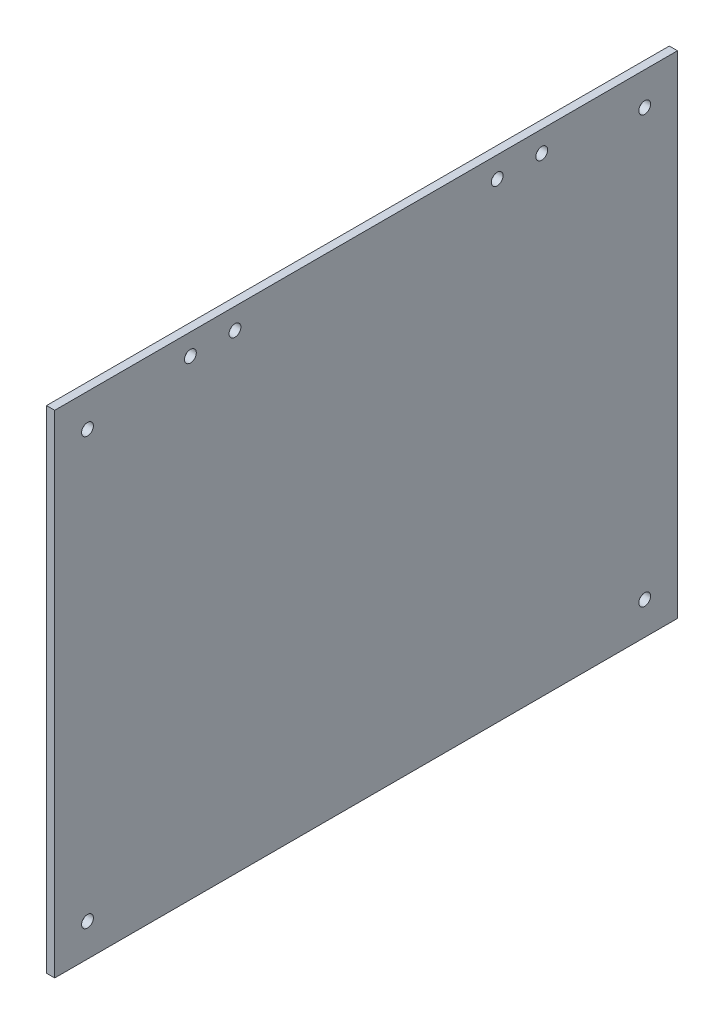
from build123d import *

# Parameters (mm, degrees)
SKETCH1_W           = 241.3
SKETCH1_H           = 190.5
BOSS_EXTRUDE1_DEPTH = 3.175
SKETCH2_R           = 2.286
CUT_EXTRUDE1_DEPTH  = 308.450842616
SKETCH3_R           = 2.286
CUT_EXTRUDE2_DEPTH  = 308.450842616


with BuildPart() as part:
    # Sketch1 → Boss-Extrude1 (new body)
    with BuildSketch(Plane(origin=(0, 0, 0), x_dir=(0, 0, -1), z_dir=(1, 0, 0))):
        with Locations((120.65, 95.25)):
            Rectangle(SKETCH1_W, SKETCH1_H)
    extrude(amount=BOSS_EXTRUDE1_DEPTH)

    # Sketch2 → Cut-Extrude1 (cut, through all)
    with BuildSketch(Plane(origin=(3.175, 0, 0), x_dir=(0, 0, -1), z_dir=(1, 0, 0))):
        with Locations((228.6, 12.7)):
            Circle(SKETCH2_R)
        with Locations((228.6, 177.8)):
            Circle(SKETCH2_R)
        with Locations((12.7, 12.7)):
            Circle(SKETCH2_R)
        with Locations((12.7, 177.8)):
            Circle(SKETCH2_R)
    extrude(amount=-CUT_EXTRUDE1_DEPTH, mode=Mode.SUBTRACT)

    # Sketch3 → Cut-Extrude2 (cut, through all)
    with BuildSketch(Plane(origin=(3.175, 0, 0), x_dir=(0, 0, -1), z_dir=(1, 0, 0))):
        with Locations((52.578, 182.372)):
            Circle(SKETCH3_R)
        with Locations((69.85, 182.372)):
            Circle(SKETCH3_R)
        with Locations((171.45, 182.372)):
            Circle(SKETCH3_R)
        with Locations((188.722, 182.372)):
            Circle(SKETCH3_R)
    extrude(amount=-CUT_EXTRUDE2_DEPTH, mode=Mode.SUBTRACT)


solid = part.part
